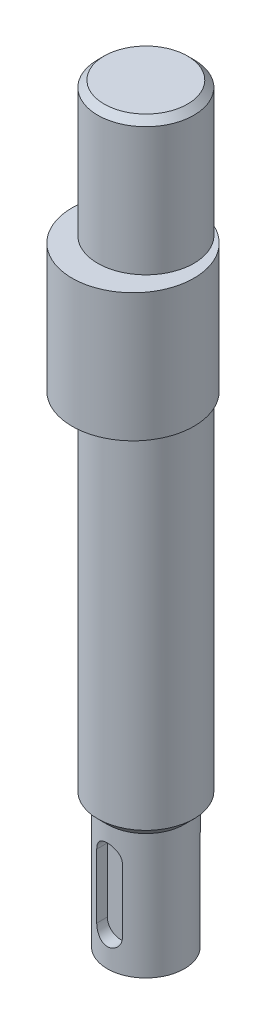
from build123d import *

# Parameters (mm, degrees)
SKETCH1_R                   = 9.5
BOSS_EXTRUDE1_DEPTH         = 20
SKETCH2_R                   = 7.5
BOSS_EXTRUDE2_DEPTH         = 58
SKETCH3_R                   = 6
BOSS_EXTRUDE3_DEPTH         = 18
BOSS_EXTRUDE4_START         = 21
SKETCH4_R                   = 7.5
BOSS_EXTRUDE4_DEPTH         = 21
CUT_EXTRUDE1_DEPTH          = 2
TAP_DRILL_FOR_M4_TAP1_D     = 5
TAP_DRILL_FOR_M4_TAP1_DEPTH = 10
TAP_DRILL_FOR_M4_TAP1_TIP   = 1.502151548
CHAMFER1_SIZE               = 1
CHAMFER2_SIZE               = 3


with BuildPart() as part:
    # Sketch1 → Boss-Extrude1 (new body)
    with BuildSketch(Plane(origin=(0, 0, 0), x_dir=(-1, 0, 0), z_dir=(0, 1, 0))):
        with Locations(Location((0, 0, 0), (0, 0, 90))):
            Circle(SKETCH1_R)
    extrude(amount=BOSS_EXTRUDE1_DEPTH)

    # Sketch2 → Boss-Extrude2 (add)
    with BuildSketch(Plane.XZ):
        with Locations(Location((0, -2, 0), (0, 0, 270))):
            Circle(SKETCH2_R)
    extrude(amount=BOSS_EXTRUDE2_DEPTH)

    # Sketch3 → Boss-Extrude3 (add)
    with BuildSketch(Plane.XZ.offset(58)):
        with Locations(Location((0, -2, 0), (0, 0, 270))):
            Circle(SKETCH3_R)
    extrude(amount=BOSS_EXTRUDE3_DEPTH)

    # Sketch4 → Boss-Extrude4 (add)
    with BuildSketch(Plane(origin=(0, 20, 0), x_dir=(-1, 0, 0), z_dir=(0, 1, 0)).offset(BOSS_EXTRUDE4_START)):
        with Locations(Location((0, -2, 0), (0, 0, 270))):
            Circle(SKETCH4_R)
    extrude(amount=-BOSS_EXTRUDE4_DEPTH)

    # Sketch5 → Cut-Extrude1 (cut)
    with BuildSketch(Plane(origin=(0, 0, 4), x_dir=(0, 1, 0), z_dir=(0, 0, 1))):
        with BuildLine():
            Line((-71, 2), (-61, 2))
            ThreePointArc((-61, 2), (-59, 0), (-61, -2))
            Line((-61, -2), (-71, -2))
            ThreePointArc((-71, -2), (-73, 0), (-71, 2))
        make_face()
    extrude(amount=-CUT_EXTRUDE1_DEPTH, mode=Mode.SUBTRACT)

    # Tap Drill for M4 Tap1
    with Locations(Plane.XZ.offset(76)):
        with Locations((0, -2)):
            Hole(TAP_DRILL_FOR_M4_TAP1_D / 2, depth=TAP_DRILL_FOR_M4_TAP1_DEPTH)
            with Locations((0, 0, -(TAP_DRILL_FOR_M4_TAP1_DEPTH + TAP_DRILL_FOR_M4_TAP1_TIP / 2))):  # 118° drill point
                Cone(0, TAP_DRILL_FOR_M4_TAP1_D / 2, TAP_DRILL_FOR_M4_TAP1_TIP, mode=Mode.SUBTRACT)

    # Chamfer1
    chamfer1_edges = [part.edges().sort_by_distance(p)[0] for p in [
        (0, 41, 5.5),
    ]]
    chamfer(chamfer1_edges, length=CHAMFER1_SIZE)

    # Chamfer2
    # the kernel refuses this chamfer: 3 mm, written as the material it takes off along each edge
    with BuildSketch(Plane(origin=(0, -58, -2), x_dir=(0, 0, -1), z_dir=(-1, 0, 0))) as chamfer2_piece_1_section:
        Polygon((7.5, -CHAMFER2_SIZE), (7.5 - CHAMFER2_SIZE, 0), (7.5, 0), align=None)
    chamfer2_piece_1 = revolve(axis=Axis((0, -58, -2), (0, -1, 0)), mode=Mode.PRIVATE)
    chamfer2_piece_1 = chamfer2_piece_1 - Plane(origin=(0, -55.74588243, -2), x_dir=(0, 0, -1), z_dir=(0, 1, 0)) * Cylinder(6, 30, mode=Mode.PRIVATE)
    add(chamfer2_piece_1, mode=Mode.SUBTRACT)


solid = part.part
